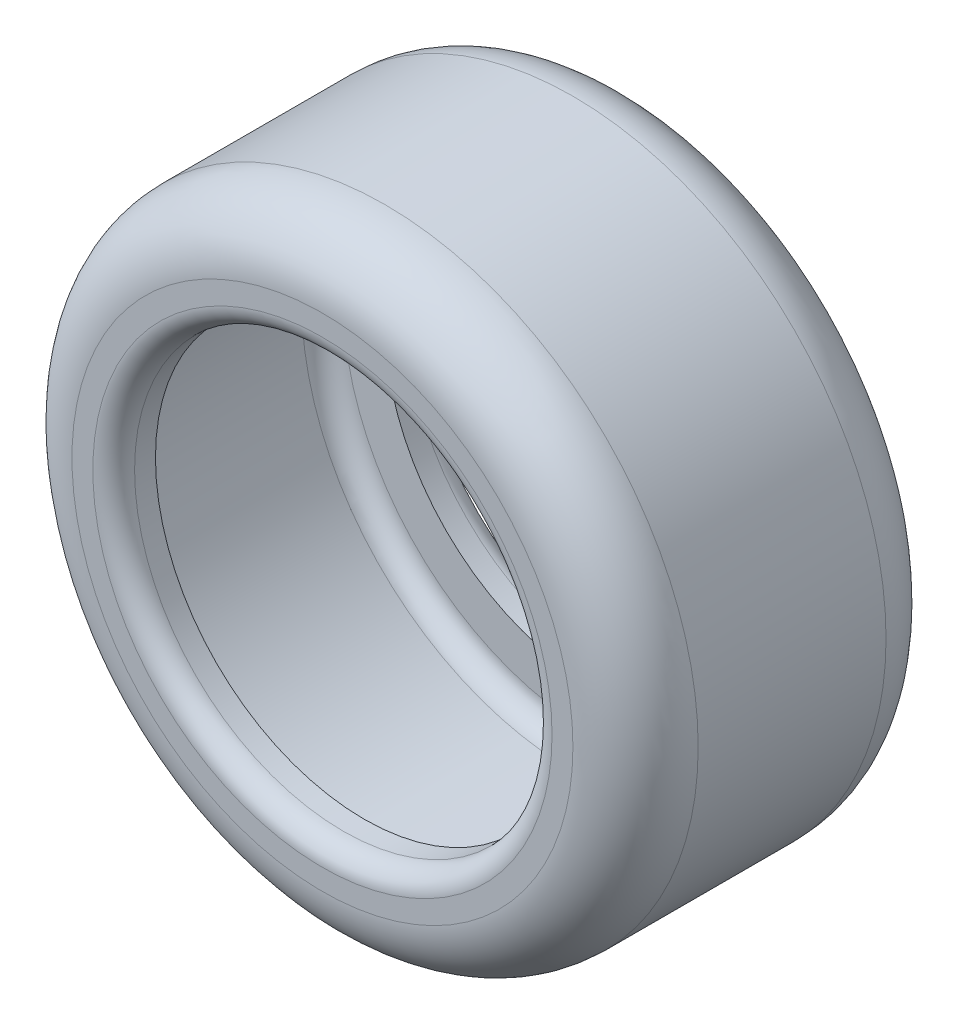
from build123d import *

# Parameters (mm, degrees)
SKETCH2_R           = 38.1
SKETCH2_R_2         = 25.4
EXTRUDE_THIN1_DEPTH = 38.1
FILLET1_R           = 7.62
FILLET2_R           = 2.54


# Read off the part's stored shape, not the designer's step: Shell1
with BuildPart() as part:
    # Sketch2 → Extrude-Thin1 (new body)
    with BuildSketch(Plane.XY):
        with Locations((-15.434042746, 9.059112046)):
            Circle(SKETCH2_R)
        with Locations((-15.434042746, 9.059112046)):
            Circle(SKETCH2_R_2, mode=Mode.SUBTRACT)
    extrude(amount=EXTRUDE_THIN1_DEPTH)

    # Fillet1
    fillet1_edges = [part.edges().sort_by_distance(p)[0] for p in [
        (-53.534042746, 9.059112046, 0),
        (-53.534042746, 9.059112046, 38.1),
    ]]
    fillet(fillet1_edges, radius=FILLET1_R)

    # Fillet2
    fillet2_edges = [part.edges().sort_by_distance(p)[0] for p in [
        (-40.834042746, 9.059112046, 0),
        (-40.834042746, 9.059112046, 38.1),
    ]]
    fillet(fillet2_edges, radius=FILLET2_R)

    # Shell1 outline → Shell1 (revolve, cut)
    with BuildSketch(Plane(origin=(-15.434042746, 9.059112046, 0), x_dir=(1, 0, 0), z_dir=(0, -1, 0))):
        with BuildLine():
            Line((30.48, 33.02), (25.4, 33.02))
            Line((25.4, 33.02), (25.4, 5.08))
            Line((25.4, 5.08), (30.48, 5.08))
            ThreePointArc((30.48, 5.08), (32.276051224, 5.823948776), (33.02, 7.62))
            Line((33.02, 7.62), (33.02, 30.48))
            ThreePointArc((33.02, 30.48), (32.276051224, 32.276051224), (30.48, 33.02))
        make_face()
    revolve(axis=Axis((-15.434042746, 9.059112046, 0), (0, 0, 1)), mode=Mode.SUBTRACT)


solid = part.part
